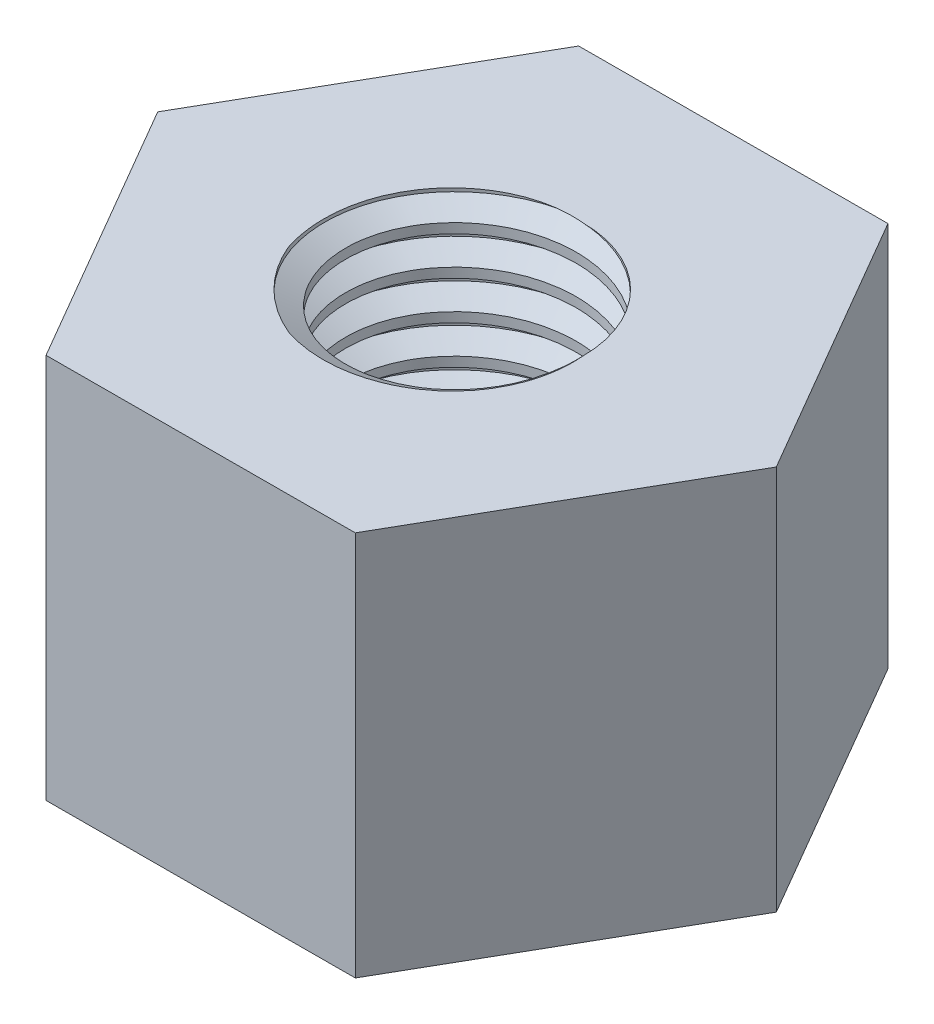
from build123d import *
from build123d.topology import SkipClean

# Parameters (mm, degrees)
EXTRUDE_1_DEPTH     = 5
SKETCH_2_R          = 1.5
CUT_EXTRUDE_1_DEPTH = 10
THREAD_1_PITCH      = 0.5


with BuildPart() as part:
    # Sketch 1 → 凸台-拉伸1 (new body)
    with BuildSketch(Plane(origin=(0, 0, 0), x_dir=(1, 0, 0), z_dir=(0, 1, 0))):
        Polygon((2.009841429, -3.458419663), (4, 0.011363904), (1.990158571, 3.469783567), (-2.009841429, 3.458419663), (-4, -0.011363904), (-1.990158571, -3.469783567), align=None)
    extrude(amount=EXTRUDE_1_DEPTH)

    # 草图2 → 切除-拉伸1 (cut)
    with BuildSketch(Plane.XZ):
        with Locations(Location((0, 0, 0), (0, 0, 270))):
            Circle(SKETCH_2_R)
    extrude(amount=-CUT_EXTRUDE_1_DEPTH, mode=Mode.SUBTRACT)

    # 螺纹线1: the profile of Sketch 1 2 profile screwed along a right-hand helix of 16 turns, 6 arcs to a turn; built about Z, then put on its axis
    with SkipClean():  # the faces are left unmerged after this step: merging them gives an invalid solid
        thread_1_z = Axis((0, 0, 0), (0, 0, 1))
        thread_1_corners = [(1.4997, 0, -0.000173205), (1.770632938, 0, 0.156249999), (1.770632938, 0, 0.218749999), (1.4997, 0, 0.375173204)]
        with BuildLine(mode=Mode.PRIVATE) as thread_1_profile:
            Line(thread_1_corners[0], thread_1_corners[1])
            Line(thread_1_corners[1], thread_1_corners[2])
            Line(thread_1_corners[2], thread_1_corners[3])
            Line(thread_1_corners[3], thread_1_corners[0])
        thread_1_cap = Face(thread_1_profile.wire())
        thread_1_turn_angles = [0, 30, 60, 90, 120, 150, 180, 210, 240, 270, 300, 330, 360]
        thread_1_turn_weights = [1, 0.8660254037844387, 1, 0.8660254037844387, 1, 0.8660254037844387, 1, 0.8660254037844387, 1, 0.8660254037844387, 1, 0.8660254037844387, 1]
        thread_1_turn_rails = [Edge.make_bspline([Vector(p[0], p[1], 0).rotate(thread_1_z, thread_1_turn_angles[k]) / thread_1_turn_weights[k] + Vector(0, 0, p[2] + THREAD_1_PITCH * thread_1_turn_angles[k] / 360) for k in range(13)], [0, 0, 0, 1, 1, 2, 2, 3, 3, 4, 4, 5, 5, 6, 6, 6], 2, thread_1_turn_weights) for p in thread_1_corners]
        thread_1_turn_sides = [Face.make_surface_from_curves(thread_1_turn_rails[p[0]], thread_1_turn_rails[p[1]]) for p in [(0, 1), (1, 2), (2, 3), (3, 0)]]
        thread_1 = Plane(origin=(0, 0, 0), x_dir=(1, 0, 0), z_dir=(0, 1, 0)) * Solid(Shell([*[p.moved(Location((0, 0, THREAD_1_PITCH * i))) for i in range(16) for p in thread_1_turn_sides], thread_1_cap, thread_1_cap.rotate(thread_1_z, 5760).moved(Location((0, 0, THREAD_1_PITCH * 5760 / 360)))]))
        add(thread_1, mode=Mode.SUBTRACT)


solid = part.part
